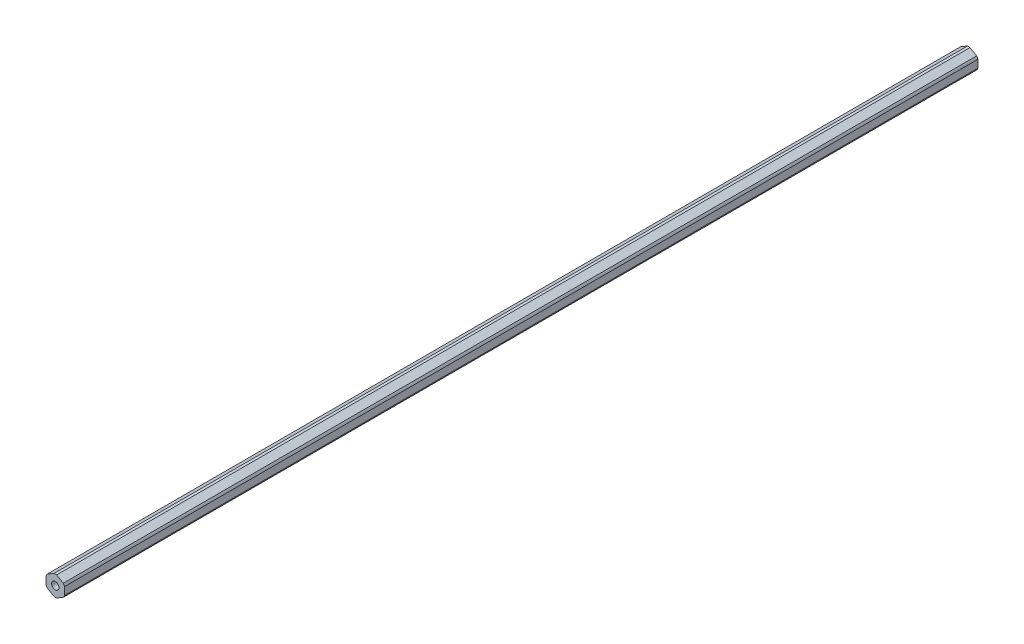
from build123d import *

# Parameters (mm, degrees)
SKETCH1_R           = 2.4892
BOSS_EXTRUDE1_DEPTH = 624.84


with BuildPart() as part:
    # Sketch1 → Boss-Extrude1 (new body)
    with BuildSketch(Plane.XY):
        with BuildLine():
            Line((-0.893039571, 6.816751782), (-5.456960429, 4.181770846))
            ThreePointArc((-5.456960429, 4.181770846), (-5.953924622, 3.437499983), (-6.35, 2.634980936))
            Line((-6.35, 2.634980936), (-6.35, -2.634980936))
            ThreePointArc((-6.35, -2.634980936), (-5.953924622, -3.437499983), (-5.456960429, -4.181770846))
            Line((-5.456960429, -4.181770846), (-0.893039571, -6.816751782))
            ThreePointArc((-0.893039571, -6.816751782), (0, -6.874999966), (0.893039571, -6.816751782))
            Line((0.893039571, -6.816751782), (5.456960429, -4.181770846))
            ThreePointArc((5.456960429, -4.181770846), (5.953924622, -3.437499983), (6.35, -2.634980936))
            Line((6.35, -2.634980936), (6.35, 2.634980936))
            ThreePointArc((6.35, 2.634980936), (5.953924622, 3.437499983), (5.456960429, 4.181770846))
            Line((5.456960429, 4.181770846), (0.893039571, 6.816751782))
            ThreePointArc((0.893039571, 6.816751782), (0, 6.874999966), (-0.893039571, 6.816751782))
        make_face()
        Circle(SKETCH1_R, mode=Mode.SUBTRACT)
    extrude(amount=-BOSS_EXTRUDE1_DEPTH)


solid = part.part
